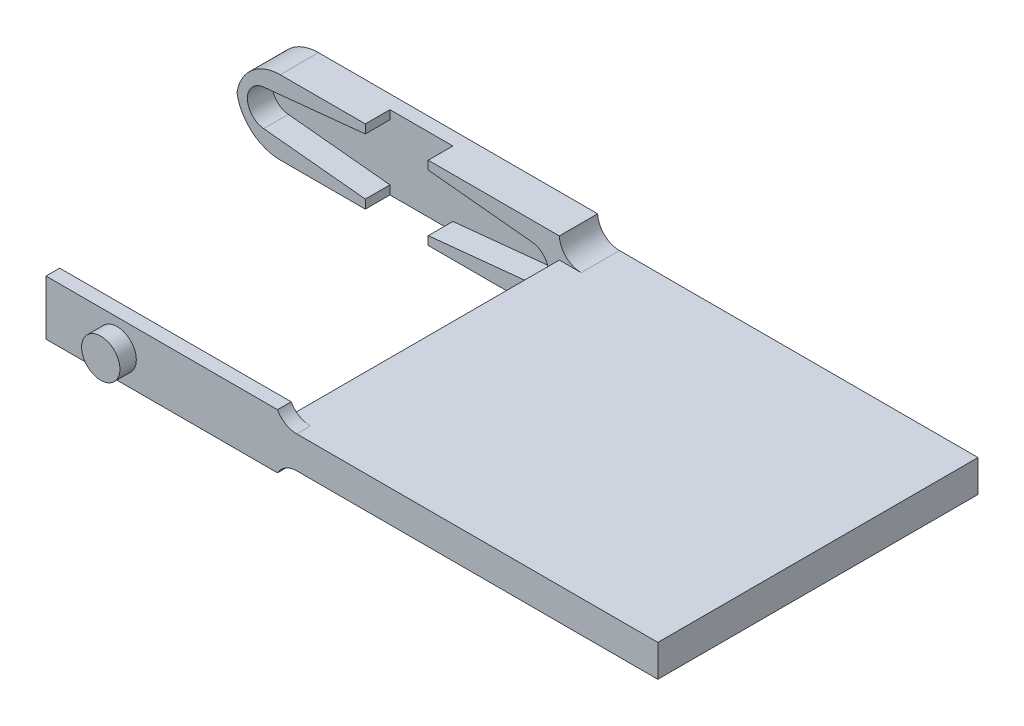
from build123d import *

# Parameters (mm, degrees)
SKETCH1_W            = 29.5
SKETCH1_H            = 6.75
BOSS_EXTRUDE10_DEPTH = 3.5
SKETCH1_16_R         = 0.291434634
BOSS_EXTRUDE15_DEPTH = 1.25
SKETCH1_17_W         = 34.75
SKETCH1_17_H         = 2.924143722
BOSS_EXTRUDE17_DEPTH = 29.25
SKETCH2_W            = 21.15
SKETCH2_H            = 5
BOSS_EXTRUDE18_DEPTH = 1.25
FILLET1_R            = 2
FILLET2_R            = 4
CUT_EXTRUDE1_START   = -2.25
SKETCH3_W            = 5.75
SKETCH3_H            = 1.125
CUT_EXTRUDE1_DEPTH   = 2.25
SKETCH4_R            = 1.75
BOSS_EXTRUDE19_DEPTH = 1.5


with BuildPart() as part:
    # Sketch1 → Boss-Extrude10 (new body)
    with BuildSketch(Plane.XY):
        with Locations((0, 3.375)):
            Rectangle(SKETCH1_W, SKETCH1_H)
        with BuildLine():
            Line((-12.265078429, 5.016721387), (0, 6.25))
            Line((0, 6.25), (12.265078429, 5.016721387))
            ThreePointArc((12.265078429, 5.016721387), (13.75, 3.375), (12.265078429, 1.733278613))
            Line((12.265078429, 1.733278613), (0, 0.5))
            Line((0, 0.5), (-12.265078429, 1.733278613))
            ThreePointArc((-12.265078429, 1.733278613), (-13.75, 3.375), (-12.265078429, 5.016721387))
        make_face(mode=Mode.SUBTRACT)
    extrude(amount=BOSS_EXTRUDE10_DEPTH)

    # Sketch1<16> → Boss-Extrude15 (add)
    # profile 1 of 9: a face of its own
    with BuildSketch(Plane.XY):
        with BuildLine():
            Line((-0.57238697, 6.192445325), (-12.265078429, 5.016721387))
            ThreePointArc((-12.265078429, 5.016721387), (-13.75, 3.375), (-12.265078429, 1.733278613))
            Line((-12.265078429, 1.733278613), (-0.57238697, 0.557554675))
            ThreePointArc((-0.57238697, 0.557554675), (-2.875, 3.375), (-0.57238697, 6.192445325))
        make_face()
        with Locations((-12.1, 3.375)):
            Circle(SKETCH1_16_R, mode=Mode.SUBTRACT)
        with Locations((-10.063185408, 3.375)):
            Circle(SKETCH1_16_R, mode=Mode.SUBTRACT)
        with Locations((-8.026370816, 3.375)):
            Circle(SKETCH1_16_R, mode=Mode.SUBTRACT)
    # profile 2 of 9: a face of its own
    with BuildSketch(Plane.XY):
        with Locations((-12.1, 3.375)):
            Circle(SKETCH1_16_R)
    # profile 3 of 9: a face of its own
    with BuildSketch(Plane.XY):
        with Locations((-8.026370816, 3.375)):
            Circle(SKETCH1_16_R)
    # profile 4 of 9: a face of its own
    with BuildSketch(Plane.XY):
        with Locations((-10.063185408, 3.375)):
            Circle(SKETCH1_16_R)
    # profile 5 of 9: a face of its own
    with BuildSketch(Plane.XY):
        with BuildLine():
            Line((0, 6.25), (-0.57238697, 6.192445325))
            ThreePointArc((-0.57238697, 6.192445325), (-2.875, 3.375), (-0.57238697, 0.557554675))
            Line((-0.57238697, 0.557554675), (0, 0.5))
            Line((0, 0.5), (0.57238697, 0.557554675))
            ThreePointArc((0.57238697, 0.557554675), (2.226121912, 1.555657748), (2.875, 3.375))
            ThreePointArc((2.875, 3.375), (2.226121912, 5.194342252), (0.57238697, 6.192445325))
            Line((0.57238697, 6.192445325), (0, 6.25))
        make_face()
    # profile 6 of 9: a face of its own
    with BuildSketch(Plane.XY):
        with BuildLine():
            Line((12.265078429, 5.016721387), (0.57238697, 6.192445325))
            ThreePointArc((0.57238697, 6.192445325), (2.226121912, 5.194342252), (2.875, 3.375))
            ThreePointArc((2.875, 3.375), (2.226121912, 1.555657748), (0.57238697, 0.557554675))
            Line((0.57238697, 0.557554675), (12.265078429, 1.733278613))
            ThreePointArc((12.265078429, 1.733278613), (13.75, 3.375), (12.265078429, 5.016721387))
        make_face()
        with Locations((8.026370816, 3.375)):
            Circle(SKETCH1_16_R, mode=Mode.SUBTRACT)
        with Locations((10.063185408, 3.375)):
            Circle(SKETCH1_16_R, mode=Mode.SUBTRACT)
        with Locations((12.1, 3.375)):
            Circle(SKETCH1_16_R, mode=Mode.SUBTRACT)
    # profile 7 of 9: a face of its own
    with BuildSketch(Plane.XY):
        with Locations((12.1, 3.375)):
            Circle(SKETCH1_16_R)
    # profile 8 of 9: a face of its own
    with BuildSketch(Plane.XY):
        with Locations((10.063185408, 3.375)):
            Circle(SKETCH1_16_R)
    # profile 9 of 9: a face of its own
    with BuildSketch(Plane.XY):
        with Locations((8.026370816, 3.375)):
            Circle(SKETCH1_16_R)
    extrude(amount=BOSS_EXTRUDE15_DEPTH)

    # Sketch1<17> → Boss-Extrude17 (add)
    with BuildSketch(Plane.XY):
        with Locations((32.125, 3.375)):
            Rectangle(SKETCH1_17_W, SKETCH1_17_H)
    extrude(amount=BOSS_EXTRUDE17_DEPTH)

    # Sketch2 → Boss-Extrude18 (add)
    with BuildSketch(Plane.XY.offset(29.25)):
        with Locations((4.175, 3.375)):
            Rectangle(SKETCH2_W, SKETCH2_H)
    extrude(amount=-BOSS_EXTRUDE18_DEPTH)

    # Fillet1
    # the kernel refuses this fillet: 2 mm, written as the material it adds along each edge
    with BuildSketch(Plane(origin=(14.75, 1.912928139, 0), x_dir=(0, -1, 0), z_dir=(0, 0, 1))) as fillet1_piece_1:
        with BuildLine():
            CenterArc((2, 1.998103724), FILLET1_R, 180, 87.504786267)
            Line((0, 1.998103724), (0, 0))
            Line((0, 0), (1.912928139, 0))
        make_face()
    extrude(amount=3.5)
    with BuildSketch(Plane(origin=(14.75, 4.837071861, 0), x_dir=(1, 0, 0), z_dir=(0, 0, 1))) as fillet1_piece_2:
        with BuildLine():
            CenterArc((1.998103724, 2), FILLET1_R, 182.495213733, 87.504786267)
            Line((0, 1.912928139), (0, 0))
            Line((0, 0), (1.998103724, 0))
        make_face()
    extrude(amount=3.5)
    with BuildSketch(Plane(origin=(14.75, 4.837071861, 28), x_dir=(1, 0, 0), z_dir=(0, 0, 1))) as fillet1_piece_3:
        with BuildLine():
            CenterArc((1.753401761, 2), FILLET1_R, 208.753082152, 61.246917848)
            Line((0, 1.037928139), (0, 0))
            Line((0, 0), (1.753401761, 0))
        make_face()
    extrude(amount=1.25)
    with BuildSketch(Plane(origin=(14.75, 1.912928139, 28), x_dir=(1, 0, 0), z_dir=(0, 0, 1))) as fillet1_piece_4:
        with BuildLine():
            CenterArc((1.753401761, -2), FILLET1_R, 90, 61.246917848)
            Line((0, -1.037928139), (0, 0))
            Line((0, 0), (1.753401761, 0))
        make_face()
    extrude(amount=1.25)

    # Fillet2
    # the kernel refuses this fillet: 4 mm, written as the material it takes off along each edge
    with BuildSketch(Plane(origin=(-14.75, 6.75, -10), x_dir=(0, -1, 0), z_dir=(0, 0, 1)), Plane(origin=(-14.75, 0, -10), x_dir=(1, 0, 0), z_dir=(0, 0, 1))) as fillet2_piece_1:
        with BuildLine():
            CenterArc((FILLET2_R, FILLET2_R), FILLET2_R, 180, 90)
            Line((0, FILLET2_R), (0, 0))
            Line((0, 0), (FILLET2_R, 0))
        make_face()
    extrude(amount=23.5, mode=Mode.SUBTRACT)

    # Sketch3 → Cut-Extrude1 (cut)
    with BuildSketch(Plane.XY.offset(3.5).offset(CUT_EXTRUDE1_START)):
        with Locations((-0.102107464, 6.1875)):
            Rectangle(SKETCH3_W, SKETCH3_H)
        with Locations((-0.102107464, 0.5625)):
            Rectangle(SKETCH3_W, SKETCH3_H)
    extrude(amount=CUT_EXTRUDE1_DEPTH, mode=Mode.SUBTRACT)

    # Sketch4 → Boss-Extrude19 (add)
    with BuildSketch(Plane.XY.offset(29.25)):
        with Locations((0.102107464, 3.375)):
            Circle(SKETCH4_R)
    extrude(amount=BOSS_EXTRUDE19_DEPTH)


solid = part.part
